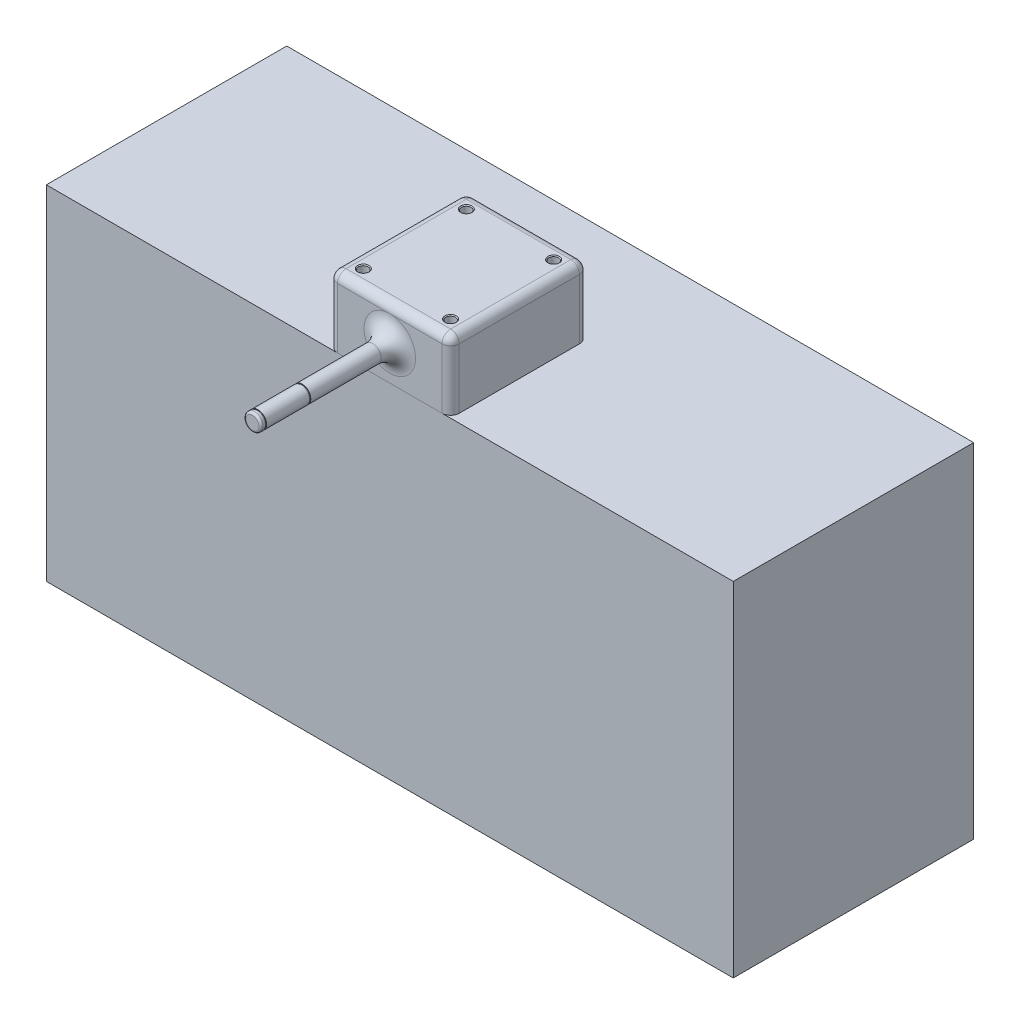
from build123d import *

# Parameters (mm, degrees)
SKETCH1_W                         = 90
SKETCH1_H                         = 50.8
BOSS_EXTRUDE1_DEPTH               = 101.6
SKETCH1_3_R                       = 6.35
BOSS_EXTRUDE2_DEPTH               = 101.6
FILLET1_R                         = 6.35
FILLET2_R                         = 12.7
F_1_4_CLEARANCE_HOLE1_D           = 7.1374
F_1_4_CLEARANCE_HOLE1_CSINK_D     = 8.4074
F_1_4_CLEARANCE_HOLE1_CSINK_ANGLE = 90
SKETCH7_R                         = 6.35
SKETCH7_R_2                       = 5.842
CUT_EXTRUDE1_DEPTH                = 0.9525
CUT_EXTRUDE2_START                = -0.9525
SKETCH8_R                         = 6.35
SKETCH8_R_2                       = 5.842
CUT_EXTRUDE2_DEPTH                = 0.9525
FILLET3_R                         = 1.5875
SKETCH11_W                        = 508
SKETCH11_H                        = 177.8
BOSS_EXTRUDE3_DEPTH               = 254


with BuildPart() as part:
    # Sketch1 → Boss-Extrude1 (new body)
    with BuildSketch(Plane.XY):
        Rectangle(SKETCH1_W, SKETCH1_H)
    extrude(amount=-BOSS_EXTRUDE1_DEPTH)

    # Sketch1<3> → Boss-Extrude2 (add)
    with BuildSketch(Plane.XY):
        Circle(SKETCH1_3_R)
    extrude(amount=BOSS_EXTRUDE2_DEPTH)

    # Fillet1
    fillet1_edges = [part.edges().sort_by_distance(p)[0] for p in [
        (-45, 0, -101.6),
        (0, 25.4, -101.6),
        (-45, 0, 0),
        (45, 0, 0),
        (0, 25.4, 0),
        (-45, 25.4, -50.8),
        (45, 25.4, -50.8),
        (45, 0, -101.6),
    ]]
    fillet(fillet1_edges, radius=FILLET1_R)

    # Fillet2
    fillet2_edges = [part.edges().sort_by_distance(p)[0] for p in [
        (-6.35, 0, 0),
    ]]
    fillet(fillet2_edges, radius=FILLET2_R - 0.0001)  # a hair under: the kernel refuses the full size

    # 1/4 Clearance Hole1 (through all)
    with Locations(Plane(origin=(0, 25.4, 0), x_dir=(1, 0, 0), z_dir=(0, 1, 0))):
        with Locations((-32.3, 88.9), (-32.3, 12.7), (32.3, 12.7), (32.3, 88.9)):
            CounterSinkHole(F_1_4_CLEARANCE_HOLE1_D / 2, F_1_4_CLEARANCE_HOLE1_CSINK_D / 2, counter_sink_angle=F_1_4_CLEARANCE_HOLE1_CSINK_ANGLE)

    # Sketch7 → Cut-Extrude1 (cut)
    with BuildSketch(Plane.XY.offset(97.4725)):
        with Locations(Location((0, 0, 0), (0, 0, 180))):
            Circle(SKETCH7_R)
        Circle(SKETCH7_R_2, mode=Mode.SUBTRACT)
    extrude(amount=CUT_EXTRUDE1_DEPTH, mode=Mode.SUBTRACT)

    # Sketch8 → Cut-Extrude2 (cut)
    with BuildSketch(Plane.XY.offset(65.7225).offset(CUT_EXTRUDE2_START)):
        with Locations(Location((0, 0, 0), (0, 0, 180))):
            Circle(SKETCH8_R)
        Circle(SKETCH8_R_2, mode=Mode.SUBTRACT)
    extrude(amount=CUT_EXTRUDE2_DEPTH, mode=Mode.SUBTRACT)

    # Fillet3
    fillet3_edges = [part.edges().sort_by_distance(p)[0] for p in [
        (-6.35, 0, 101.6),
    ]]
    fillet(fillet3_edges, radius=FILLET3_R)


with BuildPart() as body_2:
    # Sketch11 → Boss-Extrude3 (new body)
    with BuildSketch(Plane.XZ.offset(25.4)):
        with Locations((0, -88.9)):
            Rectangle(SKETCH11_W, SKETCH11_H)
    extrude(amount=BOSS_EXTRUDE3_DEPTH)


solid = Compound([part.part, body_2.part])
